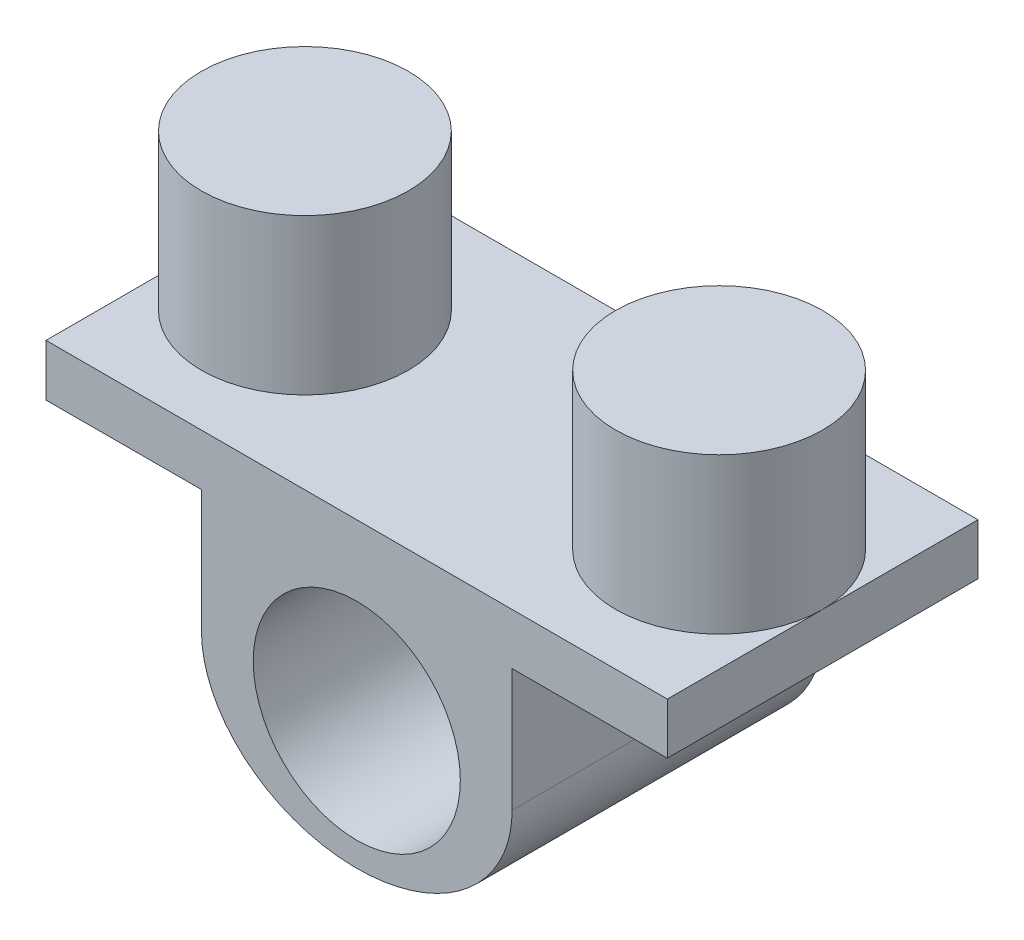
from build123d import *

# Parameters (mm, degrees)
EXTRUDE_2_OUTLINE_R = 20
EXTRUDE_2_DEPTH     = 60
SKETCH_2_R          = 20
EXTRUDE_3_DEPTH     = 30


# Read off the part's stored shape, not the designer's step: 凸台-拉伸2
with BuildPart() as part:
    # 凸台-拉伸2 outline → 凸台-拉伸2 (new body)
    with BuildSketch(Plane.XY):
        with BuildLine():
            Line((-60.021729867, 23.609441277), (-29.999981028, 23.664576029))
            Line((-29.999981028, 23.664576029), (-29.999981028, -0.027547365))
            add(Edge.make_bspline(
                [(-29.999981028, -0.027547365), (-29.977301164, -24.726661617), (0.022679865, -24.699114252), (30.022660893, -24.671566888), (29.999981028, 0.027547365)],
                knots=[0, 0, 0, 1.570796327, 1.570796327, 3.141592654, 3.141592654, 3.141592654], degree=2, weights=[1, 0.707106781, 1, 0.707106781, 1]))
            Line((29.999981028, 0.027547365), (29.999981028, 23.719630805))
            Line((29.999981028, 23.719630805), (59.978270133, 23.719630805))
            Line((59.978270133, 23.719630805), (59.978270133, 33.609441277))
            Line((59.978270133, 33.609441277), (-60.021729867, 33.609441277))
            Line((-60.021729867, 33.609441277), (-60.021729867, 23.609441277))
        make_face()
        Circle(EXTRUDE_2_OUTLINE_R, mode=Mode.SUBTRACT)
    extrude(amount=EXTRUDE_2_DEPTH)

    # 草图2 → 凸台-拉伸3 (add)
    with BuildSketch(Plane(origin=(0, 33.609441277, 0), x_dir=(-1, 0, 0), z_dir=(0, 1, 0))):
        with Locations(Location((-39.978270133, 30, 0), (0, 0, 180))):
            Circle(SKETCH_2_R)
        with Locations((40.021729867, 30)):
            Circle(SKETCH_2_R)
    extrude(amount=EXTRUDE_3_DEPTH)


solid = part.part
